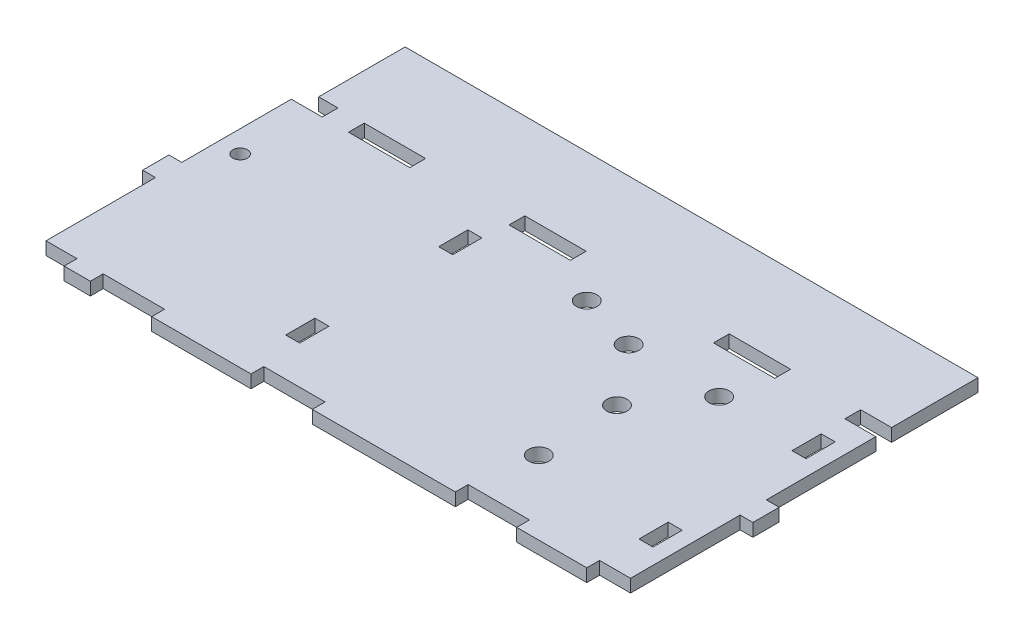
from build123d import *

# Parameters (mm, degrees)
SKETCH1_W           = 26.67
SKETCH1_H           = 6.858
BOSS_EXTRUDE1_DEPTH = 5.588
CUT_EXTRUDE1_REACH  = 184.177
SKETCH9_W           = 6.096
SKETCH9_H           = 12.7
CUT_EXTRUDE2_REACH  = 184.177
SKETCH12_R          = 3.175
CUT_EXTRUDE3_REACH  = 184.177
SKETCH13_R          = 4.445


with BuildPart() as part:
    # Sketch1 → Boss-Extrude1 (new body)
    with BuildSketch(Plane(origin=(0, 0, 0), x_dir=(1, 0, 0), z_dir=(0, 1, 0))):
        Polygon((-110.690062624, 12.380140685), (-116.278062624, 12.380140685), (-116.278062624, 0.950140685), (-110.690062624, 0.950140685), (-110.690062624, -46.674859251), (-97.228062624, -46.674859251), (-97.228062624, -52.262859251), (-85.798062624, -52.262859251), (-85.798062624, -46.674859251), (-59.128062624, -46.674859251), (-59.128062624, -52.262859251), (-15.948062624, -52.262859251), (-15.948062624, -46.674859251), (10.721937376, -46.674859251), (10.721937376, -52.262859251), (72.951937376, -52.262859251), (72.951937376, -46.674859251), (99.621937376, -46.674859251), (99.621937376, -52.262859251), (130.101937376, -52.262859251), (130.101937376, -46.67485938), (143.563937376, -46.67485938), (143.563937376, 0.950140682), (149.151937376, 0.950140682), (149.151937376, 12.38014062), (143.563937376, 12.38014062), (143.563937376, 60.00514062), (130.101937376, 60.00514062), (130.101937376, 66.86314062), (143.563937376, 66.86314062), (143.563937376, 104.45514062), (-105.610062624, 104.45514062), (-105.610062624, 66.86314062), (-97.228062624, 66.86314062), (-97.228062624, 60.00514062), (-110.690062624, 60.00514062), align=None)
        with Locations((-72.463062624, 63.43414062)):
            Rectangle(SKETCH1_W, SKETCH1_H, mode=Mode.SUBTRACT)
        with Locations((-2.613062624, 63.43414062)):
            Rectangle(SKETCH1_W, SKETCH1_H, mode=Mode.SUBTRACT)
        with Locations((86.286937376, 63.43414062)):
            Rectangle(SKETCH1_W, SKETCH1_H, mode=Mode.SUBTRACT)
    extrude(amount=BOSS_EXTRUDE1_DEPTH)

    # Sketch9 → Cut-Extrude1 (cut, up to next)
    with BuildSketch(Plane(origin=(0, 5.588, 0), x_dir=(1, 0, 0), z_dir=(0, 1, 0)), mode=Mode.PRIVATE) as cut_extrude1_sk1:
        with Locations((-20.012062624, -23.687859251)):
            Rectangle(SKETCH9_W, SKETCH9_H)
    cut_extrude1_tool1 = extrude(cut_extrude1_sk1.sketch, amount=-CUT_EXTRUDE1_REACH, mode=Mode.PRIVATE) & part.part
    # Sketch9 → Cut-Extrude1 (cut, up to next)
    with BuildSketch(Plane(origin=(0, 5.588, 0), x_dir=(1, 0, 0), z_dir=(0, 1, 0)), mode=Mode.PRIVATE) as cut_extrude1_sk2:
        with Locations((-20.012062624, 42.860140749)):
            Rectangle(SKETCH9_W, SKETCH9_H)
    cut_extrude1_tool2 = extrude(cut_extrude1_sk2.sketch, amount=-CUT_EXTRUDE1_REACH, mode=Mode.PRIVATE) & part.part
    # Sketch9 → Cut-Extrude1 (cut, up to next)
    with BuildSketch(Plane(origin=(0, 5.588, 0), x_dir=(1, 0, 0), z_dir=(0, 1, 0)), mode=Mode.PRIVATE) as cut_extrude1_sk3:
        with Locations((133.657937376, -23.687859251)):
            Rectangle(SKETCH9_W, SKETCH9_H)
    cut_extrude1_tool3 = extrude(cut_extrude1_sk3.sketch, amount=-CUT_EXTRUDE1_REACH, mode=Mode.PRIVATE) & part.part
    # Sketch9 → Cut-Extrude1 (cut, up to next)
    with BuildSketch(Plane(origin=(0, 5.588, 0), x_dir=(1, 0, 0), z_dir=(0, 1, 0)), mode=Mode.PRIVATE) as cut_extrude1_sk4:
        with Locations((133.657937376, 42.860140749)):
            Rectangle(SKETCH9_W, SKETCH9_H)
    cut_extrude1_tool4 = extrude(cut_extrude1_sk4.sketch, amount=-CUT_EXTRUDE1_REACH, mode=Mode.PRIVATE) & part.part
    add(cut_extrude1_tool1.solids().sort_by_distance((-20.012063, 5.588, 23.687859))[0], mode=Mode.SUBTRACT)
    add(cut_extrude1_tool2.solids().sort_by_distance((-20.012063, 5.588, -42.860141))[0], mode=Mode.SUBTRACT)
    add(cut_extrude1_tool3.solids().sort_by_distance((133.657937, 5.588, 23.687859))[0], mode=Mode.SUBTRACT)
    add(cut_extrude1_tool4.solids().sort_by_distance((133.657937, 5.588, -42.860141))[0], mode=Mode.SUBTRACT)

    # Sketch12 → Cut-Extrude2 (cut, up to next)
    with BuildSketch(Plane(origin=(0, 5.588, 0), x_dir=(1, 0, 0), z_dir=(0, 1, 0)), mode=Mode.PRIVATE) as cut_extrude2_sk1:
        with Locations((-101.165062624, 28.25514062)):
            Circle(SKETCH12_R)
    cut_extrude2_tool1 = extrude(cut_extrude2_sk1.sketch, amount=-CUT_EXTRUDE2_REACH, mode=Mode.PRIVATE) & part.part
    add(cut_extrude2_tool1.solids().sort_by_distance((-101.165063, 5.588, -28.255141))[0], mode=Mode.SUBTRACT)

    # Sketch13 → Cut-Extrude3 (cut, up to next)
    with BuildSketch(Plane.XZ, mode=Mode.PRIVATE) as cut_extrude3_sk1:
        with Locations((77.273937376, 20.297859251)):
            Circle(SKETCH13_R)
    cut_extrude3_tool1 = extrude(cut_extrude3_sk1.sketch, amount=-CUT_EXTRUDE3_REACH, mode=Mode.PRIVATE) & part.part
    # Sketch13 → Cut-Extrude3 (cut, up to next)
    with BuildSketch(Plane.XZ, mode=Mode.PRIVATE) as cut_extrude3_sk2:
        with Locations((55.099783131, -40.95514062)):
            Circle(SKETCH13_R)
    cut_extrude3_tool2 = extrude(cut_extrude3_sk2.sketch, amount=-CUT_EXTRUDE3_REACH, mode=Mode.PRIVATE) & part.part
    # Sketch13 → Cut-Extrude3 (cut, up to next)
    with BuildSketch(Plane.XZ, mode=Mode.PRIVATE) as cut_extrude3_sk3:
        with Locations((94.474354319, -40.95514062)):
            Circle(SKETCH13_R)
    cut_extrude3_tool3 = extrude(cut_extrude3_sk3.sketch, amount=-CUT_EXTRUDE3_REACH, mode=Mode.PRIVATE) & part.part
    # Sketch13 → Cut-Extrude3 (cut, up to next)
    with BuildSketch(Plane.XZ, mode=Mode.PRIVATE) as cut_extrude3_sk4:
        with Locations((75.424354319, -15.55514062)):
            Circle(SKETCH13_R)
    cut_extrude3_tool4 = extrude(cut_extrude3_sk4.sketch, amount=-CUT_EXTRUDE3_REACH, mode=Mode.PRIVATE) & part.part
    # Sketch13 → Cut-Extrude3 (cut, up to next)
    with BuildSketch(Plane.XZ, mode=Mode.PRIVATE) as cut_extrude3_sk5:
        with Locations((29.478937376, -48.367787821)):
            Circle(SKETCH13_R)
    cut_extrude3_tool5 = extrude(cut_extrude3_sk5.sketch, amount=-CUT_EXTRUDE3_REACH, mode=Mode.PRIVATE) & part.part
    add(cut_extrude3_tool1.solids().sort_by_distance((77.273937, 0, 20.297859))[0], mode=Mode.SUBTRACT)
    add(cut_extrude3_tool2.solids().sort_by_distance((55.099783, 0, -40.955141))[0], mode=Mode.SUBTRACT)
    add(cut_extrude3_tool3.solids().sort_by_distance((94.474354, 0, -40.955141))[0], mode=Mode.SUBTRACT)
    add(cut_extrude3_tool4.solids().sort_by_distance((75.424354, 0, -15.555141))[0], mode=Mode.SUBTRACT)
    add(cut_extrude3_tool5.solids().sort_by_distance((29.478937, 0, -48.367788))[0], mode=Mode.SUBTRACT)


solid = part.part
